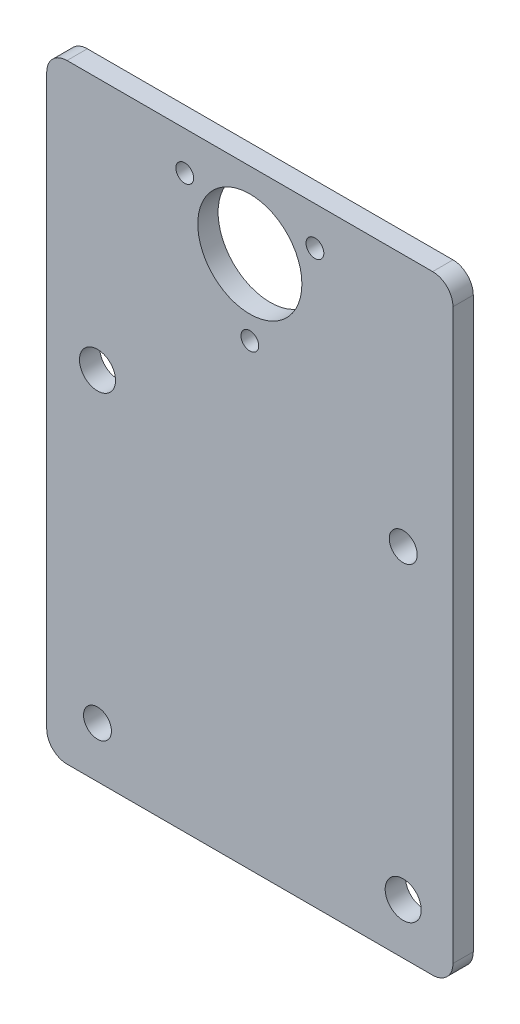
from build123d import *

# Parameters (mm, degrees)
SZKIC1_W                    = 80
SZKIC1_H                    = 120
SZKIC1_R                    = 3.55
SZKIC1_R_2                  = 2.75
SZKIC1_R_3                  = 10.25
SZKIC1_R_4                  = 1.75
DODANIE_WYCI_GNI_CIE1_DEPTH = 4
ZAOKR_GLENIE1_R             = 4


with BuildPart() as part:
    # Szkic1 → Dodanie-wyciągnięcie1 (new body)
    with BuildSketch(Plane.XY):
        with Locations((2.652979088, 39.242434194)):
            Rectangle(SZKIC1_W, SZKIC1_H)
        with Locations((-27.347020912, 49.442434194)):
            Circle(SZKIC1_R, mode=Mode.SUBTRACT)
        with Locations((-27.347020912, -10.757565806)):
            Circle(SZKIC1_R_2, mode=Mode.SUBTRACT)
        with Locations((32.852979088, -10.757565806)):
            Circle(SZKIC1_R, mode=Mode.SUBTRACT)
        with Locations((32.852979088, 49.442434194)):
            Circle(SZKIC1_R_2, mode=Mode.SUBTRACT)
        with Locations((2.652979088, 84.242434194)):
            Circle(SZKIC1_R_3, mode=Mode.SUBTRACT)
        with Locations((-10.164196888, 91.642434194)):
            Circle(SZKIC1_R_4, mode=Mode.SUBTRACT)
        with Locations((15.470155064, 91.642434194)):
            Circle(SZKIC1_R_4, mode=Mode.SUBTRACT)
        with Locations((2.652979088, 69.442434194)):
            Circle(SZKIC1_R_4, mode=Mode.SUBTRACT)
    extrude(amount=DODANIE_WYCI_GNI_CIE1_DEPTH)

    # Zaokrąglenie1
    zaokr_glenie1_edges = [part.edges().sort_by_distance(p)[0] for p in [
        (42.652979088, 99.242434194, 2),
        (42.652979088, -20.757565806, 2),
        (-37.347020912, -20.757565806, 2),
        (-37.347020912, 99.242434194, 2),
    ]]
    fillet(zaokr_glenie1_edges, radius=ZAOKR_GLENIE1_R)


solid = part.part
